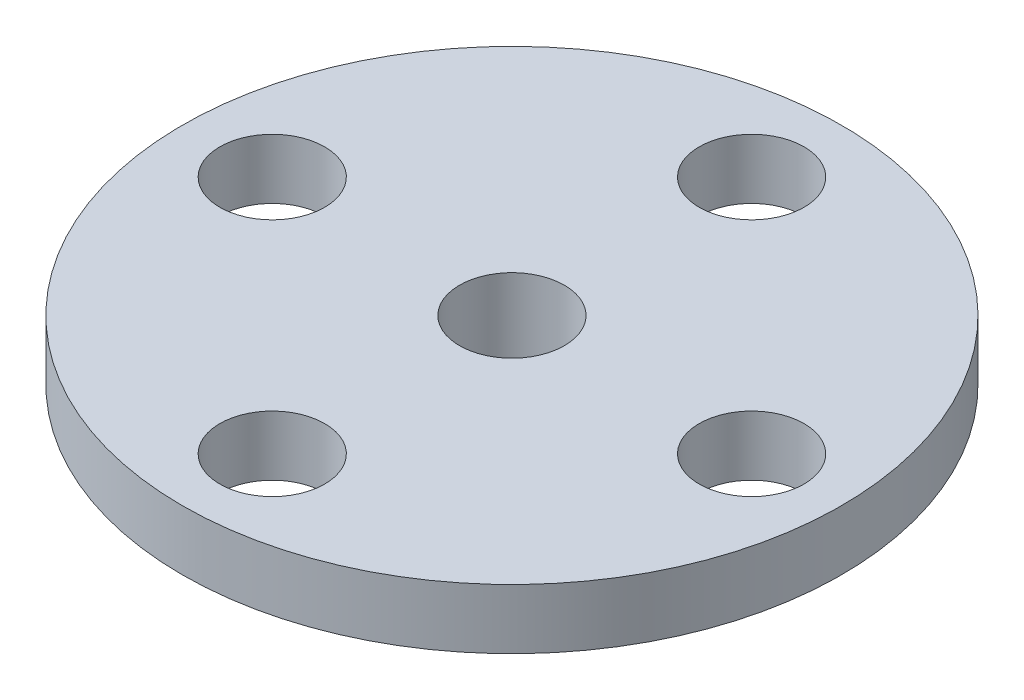
from build123d import *

# Parameters (mm, degrees)
SKETCH1_W                                        = 11
SKETCH1_H                                        = 2
SKETCH2_R                                        = 4.4
BOSS_EXTRUDE1_DEPTH                              = 4.2
F_3_5_3_5_DIAMETER_HOLE1_D                       = 3.5
CBORE_FOR_M3_HEX_HEAD_MACHINE_SCREW1_D           = 3.5
CBORE_FOR_M3_HEX_HEAD_MACHINE_SCREW1_CBORE_D     = 5.7
CBORE_FOR_M3_HEX_HEAD_MACHINE_SCREW1_CBORE_DEPTH = 3


with BuildPart() as part:
    # Sketch1 → Revolve1 (revolve)
    with BuildSketch(Plane(origin=(0, 0, 0), x_dir=(-1, 0, 0), z_dir=(0, 0, -1))):
        with Locations((-5.5, 1)):
            Rectangle(SKETCH1_W, SKETCH1_H)
    revolve(axis=Axis((0, 0, 0), (0, 1, 0)))

    # Sketch2 → Boss-Extrude1 (add)
    with BuildSketch(Plane.XZ):
        Circle(SKETCH2_R)
    extrude(amount=BOSS_EXTRUDE1_DEPTH)

    # Ø3.5 (3.5) Diameter Hole1 (through all)
    with Locations(Plane(origin=(0, 0, 0), x_dir=(-1, 0, 0), z_dir=(0, -1, 0))):
        with Locations((-8, 0), (0, -8), (8, 0), (0, 8)):
            Hole(F_3_5_3_5_DIAMETER_HOLE1_D / 2)

    # CBORE for M3 Hex Head Machine Screw1 (through all)
    with Locations(Plane(origin=(0, -4.2, 0), x_dir=(-1, 0, 0), z_dir=(0, -1, 0))):
        with Locations((0, 0)):
            CounterBoreHole(CBORE_FOR_M3_HEX_HEAD_MACHINE_SCREW1_D / 2, CBORE_FOR_M3_HEX_HEAD_MACHINE_SCREW1_CBORE_D / 2, CBORE_FOR_M3_HEX_HEAD_MACHINE_SCREW1_CBORE_DEPTH)


solid = part.part
